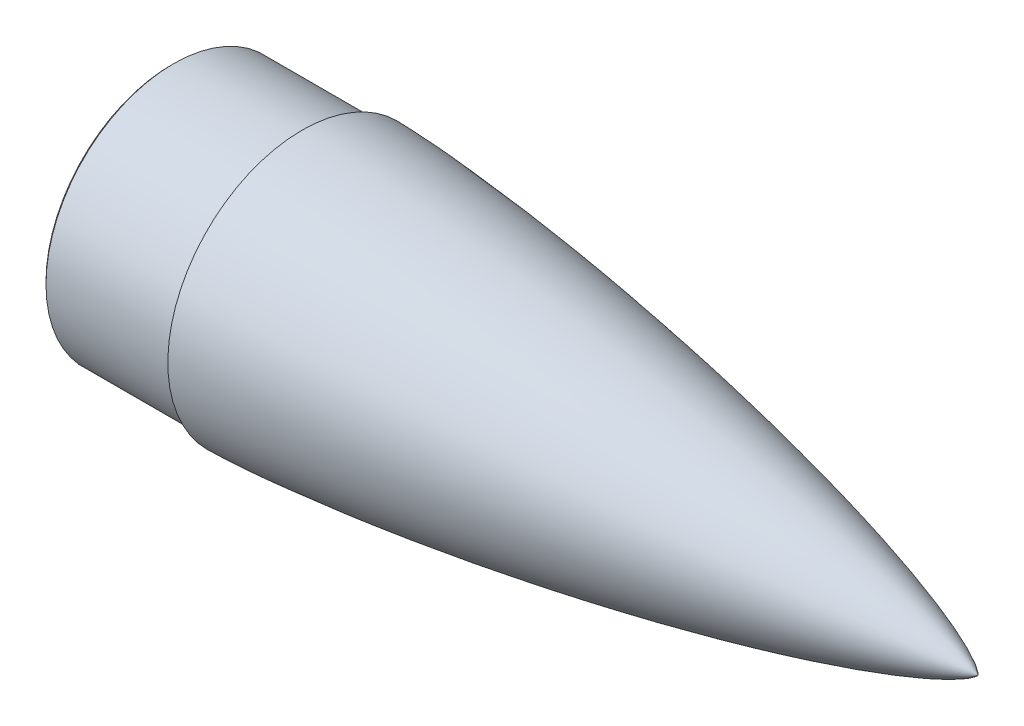
from build123d import *

# Parameters (mm, degrees)
CHAMFER1_SIZE = 1.5


with BuildPart() as part:
    # Sketch10 → Revolve1 (revolve)
    with BuildSketch(Plane.XY):
        with BuildLine():
            Line((10.607783274, 74.375), (-78.979687473, 74.375))
            Line((-78.979687473, 74.375), (-78.979687473, 77.375))
            Line((-78.979687473, 77.375), (0.395312527, 77.375))
            Line((0.395312527, 77.375), (0.395312527, 81.375))
            add(Edge.make_bspline(
                [(410.124624848, 0), (410.122101163, 0.013468319), (410.11486593, 0.039785682), (410.092652469, 0.090054685), (410.04720944, 0.173009256), (409.979879862, 0.273592857), (409.873376208, 0.41241883), (409.710195287, 0.599434754), (409.451061573, 0.863246295), (409.009612418, 1.260090637), (408.252587713, 1.859583074), (406.922597935, 2.782146711), (404.561364936, 4.211072979), (400.393786176, 6.398653946), (393.505922781, 9.531349197), (381.621034224, 14.237517007), (364.514121074, 20.086614119), (343.001204099, 26.556281543), (318.120248774, 33.235989509), (292.482707741, 39.491341086), (266.732069957, 45.262062993), (240.891113442, 50.611778343), (214.97376822, 55.577965965), (188.990036744, 60.183348339), (166.201985834, 63.906132405), (146.63509123, 66.877947571), (130.307471782, 69.204860585), (117.232605939, 70.974499029), (104.14522183, 72.649128799), (92.682988175, 74.027639811), (82.850592271, 75.143691959), (74.651866111, 76.027684121), (68.089839837, 76.706124834), (61.524769111, 77.354508235), (54.956644455, 77.971276338), (48.385467044, 78.554561198), (41.811216707, 79.102083852), (36.056034947, 79.547379929), (31.121064925, 79.902650494), (27.007266214, 80.179559478), (23.715426401, 80.388875341), (20.098263002, 80.604400265), (16.729477424, 80.788677672), (13.609275319, 80.943747425), (10.737848075, 81.071895195), (8.440289662, 81.164447118), (6.142309363, 81.246318978), (4.131195904, 81.305833648), (2.407107514, 81.347442379), (1.257553218, 81.36604481), (0.682738325, 81.374035751), (0.395312527, 81.375)],
                knots=[0, 0, 0, 0, 0, 0.000130123, 0.000260245, 0.000520491, 0.000900391, 0.00128029, 0.001925099, 0.002881508, 0.004418208, 0.006927086, 0.011110697, 0.018279138, 0.03067276, 0.051704469, 0.08310228, 0.139908797, 0.202702513, 0.265496165, 0.328289682, 0.391083359, 0.453876973, 0.516670577, 0.579464197, 0.642257765, 0.673654596, 0.705051427, 0.736448267, 0.767845106, 0.799241874, 0.814940257, 0.830638641, 0.846337073, 0.862035505, 0.877733936, 0.893432368, 0.90913072, 0.924829072, 0.932678248, 0.940527424, 0.9483766, 0.956225776, 0.967169332, 0.97264111, 0.978112888, 0.983584666, 0.989056444, 0.994528222, 0.997264111, 1, 1, 1, 1, 1], degree=4))
            Line((410.124624848, 0), (370.124624848, 0))
            add(Edge.make_bspline(
                [(370.124624848, 0), (370.122410751, 0.012294206), (370.116015469, 0.036343594), (370.096251761, 0.08237954), (370.056318262, 0.157320087), (369.997619045, 0.247627087), (369.905107145, 0.371973871), (369.762450098, 0.540776884), (369.533523811, 0.781189764), (369.141488324, 1.14426663), (368.465709313, 1.694975891), (367.278767524, 2.541643853), (365.167126527, 3.855530329), (361.45688389, 5.857822491), (355.371173453, 8.706688271), (344.918888891, 12.974871195), (329.911792079, 18.277878087), (311.055912886, 24.148502591), (289.238004273, 30.221252938), (266.749126083, 35.916964171), (244.155028685, 41.178678636), (221.476705208, 46.062870608), (198.727041153, 50.602828676), (175.915208701, 54.818663843), (155.905815789, 58.231589272), (138.722686741, 60.959785397), (124.382823112, 63.098604804), (112.898905928, 64.726895868), (101.40315792, 66.269581726), (91.334181887, 67.541190708), (82.69639697, 68.572034117), (75.493424474, 69.389510598), (69.728148637, 70.017532492), (63.959971886, 70.618406608), (58.188880494, 71.190709715), (52.414872452, 71.732739108), (46.63792191, 72.242405739), (41.580485543, 72.657772132), (37.243654688, 72.989844341), (33.628349474, 73.249202832), (30.735329004, 73.445566811), (27.579385491, 73.646750624), (24.160248428, 73.847448447), (20.970727134, 74.014905196), (18.011038847, 74.150175237), (15.543959365, 74.247090219), (13.816634661, 74.304522901), (12.335799215, 74.345452002), (11.348407435, 74.364839999), (10.854674406, 74.373370093), (10.607783274, 74.375)],
                knots=[0, 0, 0, 0, 0, 0.000134949, 0.000269899, 0.000539798, 0.000919537, 0.001299277, 0.001947431, 0.00293136, 0.004511869, 0.007081312, 0.011380263, 0.018707867, 0.031423867, 0.052705479, 0.084103008, 0.140910136, 0.203703492, 0.266497064, 0.329290816, 0.392084375, 0.454877964, 0.517671564, 0.580465191, 0.643258828, 0.674655593, 0.706052358, 0.737449114, 0.768845869, 0.800242661, 0.815941057, 0.831639453, 0.847337924, 0.863036395, 0.878734865, 0.894433336, 0.910131716, 0.925830096, 0.933679285, 0.941528475, 0.949377665, 0.957226855, 0.967920141, 0.978613427, 0.983960071, 0.989306714, 0.994653357, 0.997326678, 1, 1, 1, 1, 1], degree=4))
        make_face()
    revolve(axis=Axis((446.938975823, 0, 0), (-1, 0, 0)))

    # Chamfer1
    chamfer1_edges = [part.edges().sort_by_distance(p)[0] for p in [
        (-78.979687473, -77.375, 0),
    ]]
    chamfer(chamfer1_edges, length=CHAMFER1_SIZE)


solid = part.part
